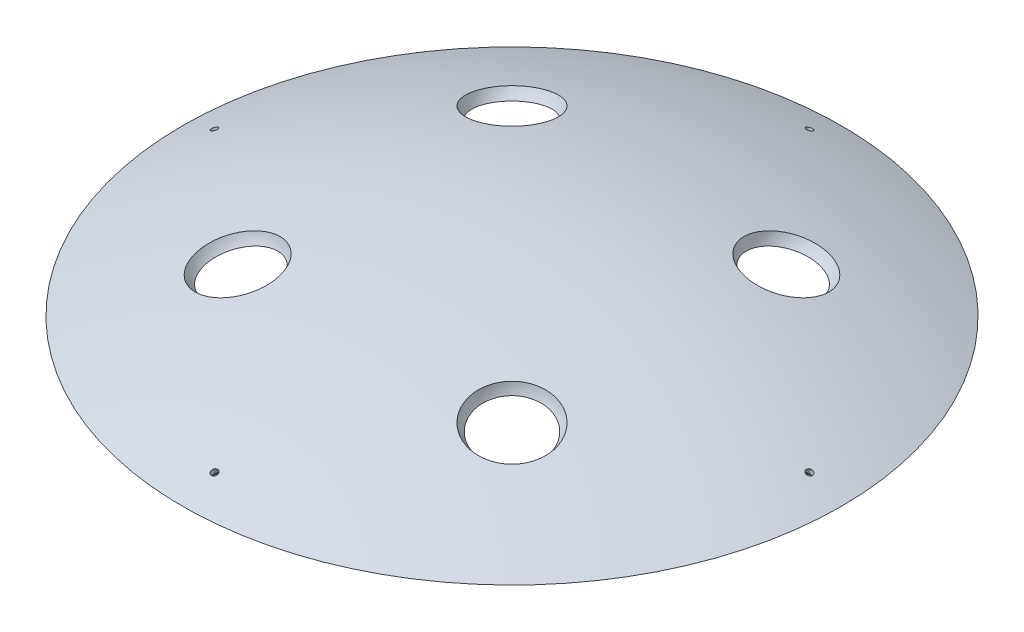
from build123d import *

# Parameters (mm, degrees)
CIRPATTERN2_COUNT = 4
CIRPATTERN3_COUNT = 4


with BuildPart() as part:
    # Sketch1 → Revolve1 (revolve)
    with BuildSketch(Plane.XY):
        with BuildLine():
            ThreePointArc((-96.45037224464366, 351.28399877517677), (-98.30491056438511, 350.49968615568724), (-100.15307171298416, 349.70046213622277))
            Line((-100.15307171298414, 349.70046213622277), (-96.45037224464365, 348.0287940258773))
            ThreePointArc((-96.45037224464366, 348.0287940258773), (-49.21182939578574, 362.6864648085931), (-8.2076e-13, 367.6385442483865))
            Line((-8.2076e-13, 367.6385442483865), (0, 370.6385442483864))
            ThreePointArc((0, 370.63854424838644), (-49.186565077785374, 365.75215426596327), (-96.45037224464366, 351.28399877517677))
        make_face()
    revolve(axis=Axis((0, 394.9444665319611, 0), (-3.49e-15, 1, 0)))

    # Sketch3 → Cut-Revolve1 (revolve, cut)
    with BuildSketch(Plane.XY):
        with BuildLine():
            ThreePointArc((-89.44663915168537, 354.08939291779734), (-89.91336288865955, 353.91003237767376), (-90.37972697038383, 353.7297387469322))
            Line((-90.37972697038381, 353.72973874693224), (-89.29517024674095, 350.932644412949))
            ThreePointArc((-89.29517024674095, 350.932644412949), (-88.36206599267746, 351.29227886698254), (-87.42751336416944, 351.64813259258915))
            Line((-87.42751336416187, 351.64813259259216), (-87.97199164739912, 353.0523534026404))
            ThreePointArc((-87.97199164739861, 353.0523534026405), (-88.43871864642989, 352.8730013089223), (-88.90508383056502, 352.6927104878234))
            Line((-88.90508383056729, 352.6927104878225), (-89.44663915168167, 354.0893929177988))
        make_face()
    cut_revolve1 = revolve(axis=Axis((4.163e-14, 120.6385442483865, 0), (-0.3615189078815354, 0.9323647779941829, 0)), mode=Mode.SUBTRACT)

    # CirPattern2: Cut-Revolve1 ×4 about axis
    cirpattern2_axis = Axis((0, 0, 0), (0, 1, 0))
    for i in range(1, CIRPATTERN2_COUNT):
        add(cut_revolve1.rotate(cirpattern2_axis, i * 360 / CIRPATTERN2_COUNT), mode=Mode.SUBTRACT)

    # Sketch5 → Cut-Revolve5 (revolve, cut)
    with BuildSketch(Plane(origin=(0, 0, 0), x_dir=(0, 1, 0), z_dir=(0.7071067811865488, 0, 0.7071067811865464))):
        with BuildLine():
            Line((380.2885442483865, 60), (354.9885442483865, 60))
            ThreePointArc((354.9885442483865, 60), (358.1637224670814, 51.618457647156696), (366.0953034914705, 47.44448694930419))
            ThreePointArc((366.0953034914705, 47.44448694930419), (376.0200866012298, 50.525178218694904), (380.2885442483865, 60))
        make_face()
    cut_revolve5 = revolve(axis=Axis((-42.426406871192775, 354.9885442483865, 42.426406871192924), (0, -1, 0)), mode=Mode.SUBTRACT)

    # CirPattern3: Cut-Revolve5 ×4 about axis
    cirpattern3_axis = Axis((0, 0, 0), (0, 1, 0))
    for i in range(1, CIRPATTERN3_COUNT):
        add(cut_revolve5.rotate(cirpattern3_axis, i * 360 / CIRPATTERN3_COUNT), mode=Mode.SUBTRACT)


solid = part.part
